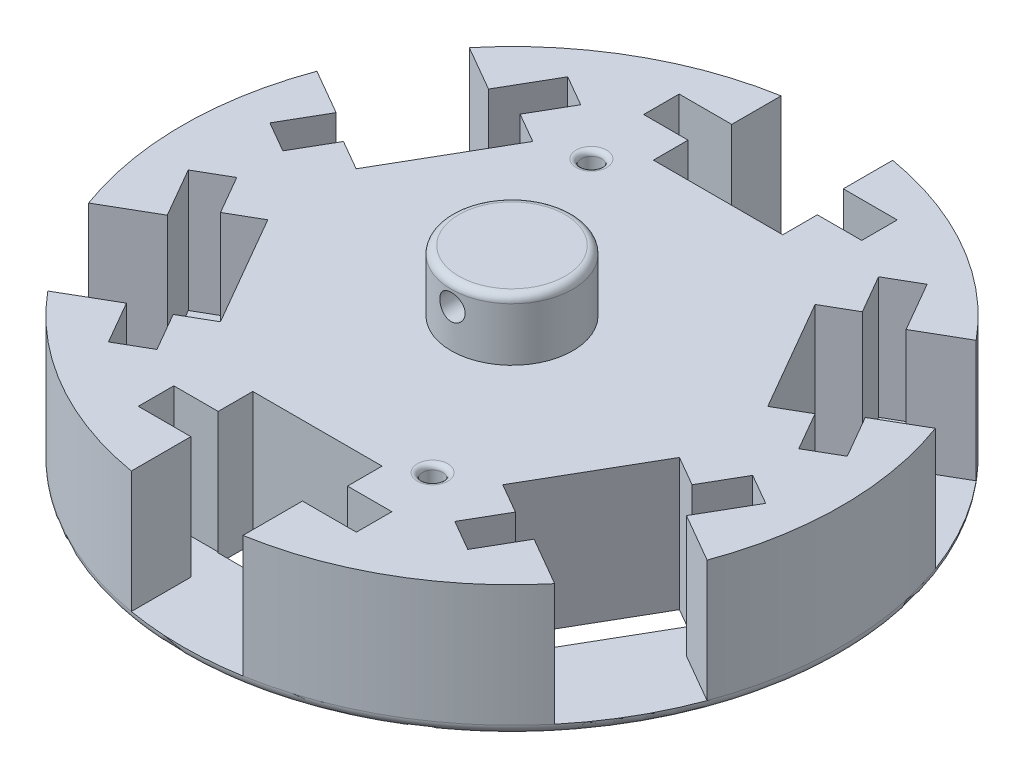
from build123d import *

# Parameters (mm, degrees)
SKETCH1_R           = 32.5
BOSS_EXTRUDE1_DEPTH = 13
SKETCH15_W          = 12.75
SKETCH15_H          = 3.5
CUT_EXTRUDE6_DEPTH  = 17
SKETCH17_W          = 21.5
SKETCH17_H          = 3.5
CUT_EXTRUDE7_DEPTH  = 12
SKETCH18_W          = 11
SKETCH18_H          = 8.891078246
CUT_EXTRUDE8_DEPTH  = 12
SKETCH19_R          = 1
CUT_EXTRUDE9_DEPTH  = 16
SKETCH21_R          = 6
BOSS_EXTRUDE3_DEPTH = 6
SKETCH24_R          = 1.25
CUT_EXTRUDE10_DEPTH = 13
FILLET4_R           = 0.5
FILLET5_R           = 0.5
FILLET7_R           = 0.75


with BuildPart() as part:
    # Sketch1 → Boss-Extrude1 (new body)
    with BuildSketch(Plane(origin=(0, 0, 0), x_dir=(1, 0, 0), z_dir=(0, 1, 0))):
        with Locations(Location((0, 0, 0), (0, 0, 90))):
            Circle(SKETCH1_R)
    extrude(amount=BOSS_EXTRUDE1_DEPTH)

    # Sketch15 → Cut-Extrude6 (cut)
    with BuildSketch(Plane(origin=(0.067128405, 13, -0.501790944), x_dir=(1, 0, 0), z_dir=(0, 1, 0))):
        Polygon((-13.916501725, 15.395911949), (-20.291501725, 4.354088051), (-23.322590638, 6.104088051), (-16.947590638, 17.145911949), align=None)
        with Locations((0, 21.5)):
            Rectangle(SKETCH15_W, SKETCH15_H)
        Polygon((-20.291501725, -4.354088051), (-13.916501725, -15.395911949), (-16.947590638, -17.145911949), (-23.322590638, -6.104088051), align=None)
        with Locations((0, -21.5)):
            Rectangle(SKETCH15_W, SKETCH15_H)
        Polygon((13.916501725, -15.395911949), (20.291501725, -4.354088051), (23.322590638, -6.104088051), (16.947590638, -17.145911949), align=None)
        Polygon((20.291501725, 4.354088051), (13.916501725, 15.395911949), (16.947590638, 17.145911949), (23.322590638, 6.104088051), align=None)
    extrude(amount=-CUT_EXTRUDE6_DEPTH, mode=Mode.SUBTRACT)

    # Sketch17 → Cut-Extrude7 (cut)
    with BuildSketch(Plane(origin=(0.067128405, 13, -0.501790944), x_dir=(1, 0, 0), z_dir=(0, 1, 0))):
        Polygon((-17.715410458, -22.641027784), (-28.465410458, -4.021481603), (-25.434321545, -2.271481603), (-14.684321545, -20.891027784), align=None)
        with Locations((0, -24.912509387)):
            Rectangle(SKETCH17_W, SKETCH17_H)
        Polygon((-28.465410458, 4.021481603), (-17.715410458, 22.641027784), (-14.684321545, 20.891027784), (-25.434321545, 2.271481603), align=None)
        with Locations((0, 24.912509387)):
            Rectangle(SKETCH17_W, SKETCH17_H)
        Polygon((17.715410458, 22.641027784), (28.465410458, 4.021481603), (25.434321545, 2.271481603), (14.684321545, 20.891027784), align=None)
        Polygon((28.465410458, -4.021481603), (17.715410458, -22.641027784), (14.684321545, -20.891027784), (25.434321545, -2.271481603), align=None)
    extrude(amount=-CUT_EXTRUDE7_DEPTH, mode=Mode.SUBTRACT)

    # Sketch18 → Cut-Extrude8 (cut)
    with BuildSketch(Plane(origin=(0, 13, 0), x_dir=(1, 0, 0), z_dir=(0, 1, 0))):
        Polygon((-25.032195505, -8.101491852), (-19.532195505, -17.627771294), (-27.232095133, -22.073310417), (-32.732095133, -12.547030975), align=None)
        with Locations((0, -30.174802269)):
            Rectangle(SKETCH18_W, SKETCH18_H)
        Polygon((-19.532195505, 17.627771294), (-25.032195505, 8.101491852), (-32.732095133, 12.547030975), (-27.232095133, 22.073310417), align=None)
        with Locations((0, 30.174802269)):
            Rectangle(SKETCH18_W, SKETCH18_H)
        Polygon((25.032195505, 8.101491852), (19.532195505, 17.627771294), (27.232095133, 22.073310417), (32.732095133, 12.547030975), align=None)
        Polygon((19.532195505, -17.627771294), (25.032195505, -8.101491852), (32.732095133, -12.547030975), (27.232095133, -22.073310417), align=None)
    extrude(amount=-CUT_EXTRUDE8_DEPTH, mode=Mode.SUBTRACT)

    # Sketch19 → Cut-Extrude9 (cut)
    with BuildSketch(Plane(origin=(0, 13, 0), x_dir=(1, 0, 0), z_dir=(0, 1, 0))):
        with Locations(Location((-9.476258541, 17.306577458, 0), (0, 0, 270))):
            Circle(SKETCH19_R)
        with Locations(Location((9.476258541, -17.306577458, 0), (0, 0, 270))):
            Circle(SKETCH19_R)
    extrude(amount=-CUT_EXTRUDE9_DEPTH, mode=Mode.SUBTRACT)

    # Sketch21 → Boss-Extrude3 (add)
    with BuildSketch(Plane(origin=(0, 13, 0), x_dir=(1, 0, 0), z_dir=(0, 1, 0))):
        with Locations(Location((0, 0, 0), (0, 0, 270))):
            Circle(SKETCH21_R)
    extrude(amount=BOSS_EXTRUDE3_DEPTH)

    # Sketch24 → Cut-Extrude10 (cut)
    with BuildSketch(Plane.XY.offset(6)):
        with Locations(Location((0, 16.747816345, 0), (0, 0, 90.000000049))):
            Circle(SKETCH24_R)
    extrude(amount=-CUT_EXTRUDE10_DEPTH, mode=Mode.SUBTRACT)

    # Fillet4
    fillet4_edges = [part.edges().sort_by_distance(p)[0] for p in [
        (-9.476258541, 13, -18.306577458),
        (9.476258541, 13, 16.306577458),
    ]]
    fillet(fillet4_edges, radius=FILLET4_R)

    # Fillet5
    fillet5_edges = [part.edges().sort_by_distance(p)[0] for p in [
        (-9.476258541, 0, -18.306577458),
        (9.476258541, 0, 16.306577458),
    ]]
    fillet(fillet5_edges, radius=FILLET5_R)

    # Fillet6: read off the stored shape, not the designer's step
    # Fillet6 outline → Fillet6 (revolve, cut)
    with BuildSketch(Plane.XY):
        with BuildLine():
            ThreePointArc((32.5, 1), (32.207106781, 0.292893219), (31.5, 0))
            Line((31.5, 0), (32.5, 0))
            Line((32.5, 0), (32.5, 1))
        make_face()
    revolve(axis=Axis((0, 0, 0), (0, 1, 0)), mode=Mode.SUBTRACT)

    # Fillet7
    fillet7_edges = [part.edges().sort_by_distance(p)[0] for p in [
        (0, 19, -6),
    ]]
    fillet(fillet7_edges, radius=FILLET7_R)


solid = part.part
